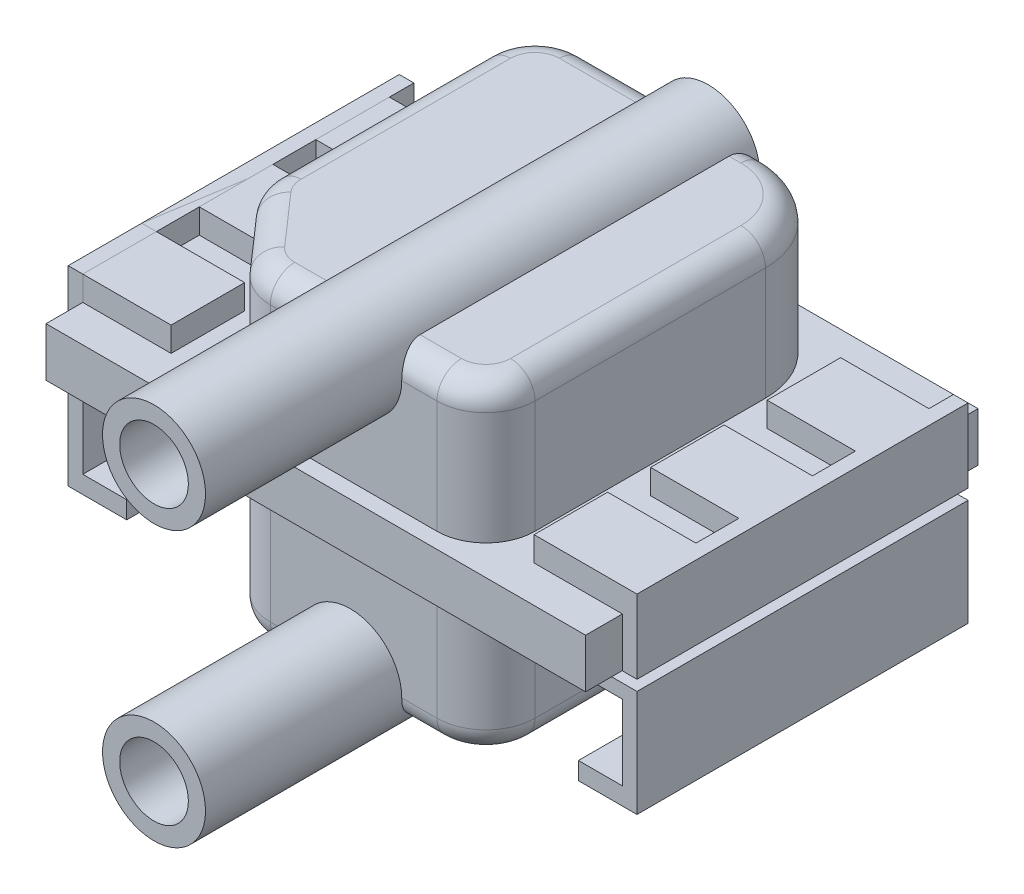
from build123d import *

# Parameters (mm, degrees)
SKETCH1_W               = 11
SKETCH1_H               = 8
BOSS_EXTRUDE1_DEPTH     = 0.5
BOSS_EXTRUDE2_DEPTH     = 2.8
FILLET2_R               = 0.5
BOSS_EXTRUDE3_REACH     = 12.007
SKETCH3_R               = 1.05
SKETCH3_R_2             = 0.7
BOSS_EXTRUDE4_START     = 4
SKETCH3_2_R             = 1.05
SKETCH3_2_R_2           = 0.7
BOSS_EXTRUDE4_DEPTH     = 4
SKETCH4_W               = 1.8
SKETCH4_H               = 1.5
BOSS_EXTRUDE5_DEPTH     = 0.5
LPATTERN1_COUNT         = 3
LPATTERN1_PITCH         = 2.375
SKETCH5_W               = 1.8
SKETCH5_H               = 1.5
BOSS_EXTRUDE6_DEPTH     = 0.5
LPATTERN2_COUNT         = 3
LPATTERN2_PITCH         = 2.375
BOSS_EXTRUDE7_START     = -1.5
BOSS_EXTRUDE7_OUTLINE_W = 0.297986137
BOSS_EXTRUDE7_OUTLINE_H = 1.504928383
BOSS_EXTRUDE7_DEPTH     = 1.5
LPATTERN6_START         = -2.891862555
LPATTERN6_OUTLINE_W     = 0.297986137
LPATTERN6_OUTLINE_H     = 5.25
LPATTERN6_DEPTH         = 2.172722131
LPATTERN6_2_OUTLINE_W   = 0.89548095
LPATTERN6_2_OUTLINE_H   = 5.25
LPATTERN6_2_DEPTH       = 0.357020068
LPATTERN6_START_2       = -1.004756479
LPATTERN6_3_OUTLINE_W   = 0.89548095
LPATTERN6_3_OUTLINE_H   = 5.25
LPATTERN6_3_DEPTH       = 0.285616055
LPATTERN6_START_3       = -0.719140424
LPATTERN6_4_OUTLINE_W   = 0.346819496
LPATTERN6_4_OUTLINE_H   = 5.25
LPATTERN6_4_DEPTH       = 0.219140424
LPATTERN6_START_4       = -3.5
LPATTERN6_5_OUTLINE_W   = 0.297986137
LPATTERN6_5_OUTLINE_H   = 1.504928383
LPATTERN6_5_DEPTH       = 5.25
LPATTERN6_6_OUTLINE_W   = 0.297986137
LPATTERN6_6_OUTLINE_H   = 1.875
LPATTERN6_6_DEPTH       = 2.172722131
LPATTERN6_7_OUTLINE_W   = 0.89548095
LPATTERN6_7_OUTLINE_H   = 1.875
LPATTERN6_7_DEPTH       = 0.357020068
LPATTERN6_8_OUTLINE_W   = 0.89548095
LPATTERN6_8_OUTLINE_H   = 1.875
LPATTERN6_8_DEPTH       = 0.285616055
LPATTERN6_9_OUTLINE_W   = 0.346819496
LPATTERN6_9_OUTLINE_H   = 1.875
LPATTERN6_9_DEPTH       = 0.219140424
LPATTERN6_START_5       = -0.125
LPATTERN6_10_OUTLINE_W  = 0.297986137
LPATTERN6_10_OUTLINE_H  = 1.504928383
LPATTERN6_10_DEPTH      = 1.875


# Read off the part's stored shape, not the designer's step: Boss-Extrude7, LPattern6
with BuildPart() as part:
    # Sketch1 → Boss-Extrude1 (new body)
    with BuildSketch(Plane(origin=(0, 0, 0), x_dir=(1, 0, 0), z_dir=(0, 1, 0))):
        Rectangle(SKETCH1_W, SKETCH1_H)
    extrude(amount=BOSS_EXTRUDE1_DEPTH)

    # Sketch2 → Boss-Extrude2 (add)
    with BuildSketch(Plane(origin=(0, 0.5, 0), x_dir=(1, 0, 0), z_dir=(0, 1, 0))):
        with BuildLine():
            Line((1.547204694, 3.619409135), (-2.15, 3.619409135))
            ThreePointArc((-2.15, 3.619409135), (-2.857106781, 3.326515916), (-3.15, 2.619409135))
            Line((-3.15, 2.619409135), (-3.15, -1.652100377))
            ThreePointArc((-3.15, -1.652100377), (-3.0858236, -2.004569084), (-2.901531621, -2.311797445))
            Line((-2.901531621, -2.311797445), (-1.998719096, -3.340287934))
            ThreePointArc((-1.998719096, -3.340287934), (-1.659681675, -3.591551092), (-1.247187475, -3.680590865))
            Line((-1.247187475, -3.680590865), (2.15, -3.680590865))
            ThreePointArc((2.15, -3.680590865), (2.857106781, -3.387697647), (3.15, -2.680590865))
            Line((3.15, -2.680590865), (3.15, 2.016613829))
            ThreePointArc((3.15, 2.016613829), (2.680552124, 3.149961258), (1.547204694, 3.619409135))
        make_face()
    extrude(amount=BOSS_EXTRUDE2_DEPTH)

    # Fillet2
    fillet2_edges = [part.edges().sort_by_distance(p)[0] for p in [
        (-2.857106781, 3.3, -3.326515916),
        (-3.15, 3.3, -0.483654379),
        (-3.0858236, 3.3, 2.004569084),
        (-2.450125358, 3.3, 2.82604269),
        (-1.659681675, 3.3, 3.591551092),
        (0.451406263, 3.3, 3.680590865),
        (2.857106781, 3.3, 3.387697647),
        (3.15, 3.3, 0.331988518),
        (2.680552124, 3.3, -3.149961258),
        (-0.301397653, 3.3, -3.619409135),
    ]]
    fillet(fillet2_edges, radius=FILLET2_R)

    # Boss-Extrude3: up to this face of the body (flat: up to its plane)
    boss_extrude3_end = Plane(part.part.faces().sort_by_distance((-0.301397653, 1.65, -3.619409135))[0])
    # Sketch3 → Boss-Extrude3 (add, up to the picked face)
    with BuildSketch(Plane.XY.offset(3.680590865), mode=Mode.PRIVATE) as boss_extrude3_sk1:
        with Locations((0.382781225, 2.8)):
            Circle(SKETCH3_R)
        with Locations((0.382781225, 2.8)):
            Circle(SKETCH3_R_2, mode=Mode.SUBTRACT)
    boss_extrude3_tool1 = split(extrude(boss_extrude3_sk1.sketch, amount=-BOSS_EXTRUDE3_REACH, mode=Mode.PRIVATE), bisect_by=boss_extrude3_end, keep=Keep.BOTH, mode=Mode.PRIVATE)
    add(boss_extrude3_tool1.solids().sort_by(Axis((-0.63752, 2.8, 3.680591), (0, 0, -1)))[0])

    # Sketch3<2> → Boss-Extrude4 (add)
    with BuildSketch(Plane.XY.offset(3.680590865).offset(BOSS_EXTRUDE4_START)):
        with Locations((0.382781225, 2.8)):
            Circle(SKETCH3_2_R)
        with Locations((0.382781225, 2.8)):
            Circle(SKETCH3_2_R_2, mode=Mode.SUBTRACT)
    extrude(amount=-BOSS_EXTRUDE4_DEPTH)

    # Mirror2: part across plane


with BuildPart() as part_1:
    add(part.part)
    add(part.part.mirror(Plane(origin=(0, 0, 0), x_dir=(0, 0, 1), z_dir=(0, -1, 0))))


with BuildPart() as body_2:
    # Sketch4 → Boss-Extrude5 (new body)
    with BuildSketch(Plane(origin=(0, 0.5, 0), x_dir=(1, 0, 0), z_dir=(0, 1, 0))):
        with Locations((-4.6, 2.25)):
            Rectangle(SKETCH4_W, SKETCH4_H)
    boss_extrude5 = extrude(amount=BOSS_EXTRUDE5_DEPTH)


with BuildPart() as lpattern1_1:
    # LPattern1: Boss-Extrude5 ×3
    with Locations(*[(0, 0, i * LPATTERN1_PITCH) for i in range(1, LPATTERN1_COUNT)]):
        add(boss_extrude5)


with BuildPart() as body_5:
    # Sketch5 → Boss-Extrude6 (new body)
    with BuildSketch(Plane(origin=(0, 0.5, 0), x_dir=(1, 0, 0), z_dir=(0, 1, 0))):
        with Locations((4.6, 2.25)):
            Rectangle(SKETCH5_W, SKETCH5_H)
    boss_extrude6 = extrude(amount=BOSS_EXTRUDE6_DEPTH)


with BuildPart() as lpattern2_1:
    # LPattern2: pattern copy
    add(boss_extrude6.moved(Location(Vector(0, 0, 1) * (1 * LPATTERN2_PITCH))))


with BuildPart() as lpattern2_2:
    # LPattern2: pattern copy
    add(boss_extrude6.moved(Location(Vector(0, 0, 1) * (2 * LPATTERN2_PITCH))))


with BuildPart() as body_8:
    # Boss-Extrude7 outline → Boss-Extrude7 (new body)
    with BuildSketch(Plane.XY.offset(3.25).offset(BOSS_EXTRUDE7_START)):
        Polygon((-4.951338546, -0.5), (-4.951338546, -0.719140424), (-5.797986137, -0.719140424), (-5.797986137, -2.891862555), (-4.60451905, -2.891862555), (-4.60451905, -2.534842487), (-5.5, -2.534842487), (-5.5, -1.004756479), (-4.60451905, -1.004756479), (-4.60451905, -0.5), align=None)
        with Locations((-5.648993069, 0.247535809)):
            Rectangle(BOSS_EXTRUDE7_OUTLINE_W, BOSS_EXTRUDE7_OUTLINE_H)
    boss_extrude7 = extrude(amount=BOSS_EXTRUDE7_DEPTH)


with BuildPart() as body_9:
    # LPattern6 outline → LPattern6 (new body)
    with BuildSketch(Plane(origin=(0, 0, 0), x_dir=(1, 0, 0), z_dir=(0, 1, 0)).offset(LPATTERN6_START)):
        with Locations((-5.648993069, 0.875)):
            Rectangle(LPATTERN6_OUTLINE_W, LPATTERN6_OUTLINE_H)
    lpattern6 = extrude(amount=LPATTERN6_DEPTH)

    # LPattern6 2 outline → LPattern6 2 (add)
    with BuildSketch(Plane(origin=(0, 0, 0), x_dir=(1, 0, 0), z_dir=(0, 1, 0)).offset(LPATTERN6_START)):
        with Locations((-5.052259525, 0.875)):
            Rectangle(LPATTERN6_2_OUTLINE_W, LPATTERN6_2_OUTLINE_H)
    lpattern6_2 = extrude(amount=LPATTERN6_2_DEPTH)

    # LPattern6 3 outline → LPattern6 3 (add)
    with BuildSketch(Plane(origin=(0, 0, 0), x_dir=(1, 0, 0), z_dir=(0, 1, 0)).offset(LPATTERN6_START_2)):
        with Locations((-5.052259525, 0.875)):
            Rectangle(LPATTERN6_3_OUTLINE_W, LPATTERN6_3_OUTLINE_H)
    lpattern6_3 = extrude(amount=LPATTERN6_3_DEPTH)

    # LPattern6 4 outline → LPattern6 4 (add)
    with BuildSketch(Plane(origin=(0, 0, 0), x_dir=(1, 0, 0), z_dir=(0, 1, 0)).offset(LPATTERN6_START_3)):
        with Locations((-4.777928798, 0.875)):
            Rectangle(LPATTERN6_4_OUTLINE_W, LPATTERN6_4_OUTLINE_H)
    lpattern6_4 = extrude(amount=LPATTERN6_4_DEPTH)


with BuildPart() as body_10:
    # LPattern6 5 outline → LPattern6 5 (new body)
    with BuildSketch(Plane.XY.offset(LPATTERN6_START_4)):
        with Locations((-5.648993069, 0.247535809)):
            Rectangle(LPATTERN6_5_OUTLINE_W, LPATTERN6_5_OUTLINE_H)
    lpattern6_5 = extrude(amount=LPATTERN6_5_DEPTH)


with BuildPart() as body_11:
    # LPattern6 6 outline → LPattern6 6 (new body)
    with BuildSketch(Plane(origin=(0, 0, 0), x_dir=(1, 0, 0), z_dir=(0, 1, 0)).offset(LPATTERN6_START)):
        with Locations((-5.648993069, -0.8125)):
            Rectangle(LPATTERN6_6_OUTLINE_W, LPATTERN6_6_OUTLINE_H)
    lpattern6_6 = extrude(amount=LPATTERN6_6_DEPTH)

    # LPattern6 7 outline → LPattern6 7 (add)
    with BuildSketch(Plane(origin=(0, 0, 0), x_dir=(1, 0, 0), z_dir=(0, 1, 0)).offset(LPATTERN6_START)):
        with Locations((-5.052259525, -0.8125)):
            Rectangle(LPATTERN6_7_OUTLINE_W, LPATTERN6_7_OUTLINE_H)
    lpattern6_7 = extrude(amount=LPATTERN6_7_DEPTH)

    # LPattern6 8 outline → LPattern6 8 (add)
    with BuildSketch(Plane(origin=(0, 0, 0), x_dir=(1, 0, 0), z_dir=(0, 1, 0)).offset(LPATTERN6_START_2)):
        with Locations((-5.052259525, -0.8125)):
            Rectangle(LPATTERN6_8_OUTLINE_W, LPATTERN6_8_OUTLINE_H)
    lpattern6_8 = extrude(amount=LPATTERN6_8_DEPTH)

    # LPattern6 9 outline → LPattern6 9 (add)
    with BuildSketch(Plane(origin=(0, 0, 0), x_dir=(1, 0, 0), z_dir=(0, 1, 0)).offset(LPATTERN6_START_3)):
        with Locations((-4.777928798, -0.8125)):
            Rectangle(LPATTERN6_9_OUTLINE_W, LPATTERN6_9_OUTLINE_H)
    lpattern6_9 = extrude(amount=LPATTERN6_9_DEPTH)


with BuildPart() as body_12:
    # LPattern6 10 outline → LPattern6 10 (new body)
    with BuildSketch(Plane.XY.offset(LPATTERN6_START_5)):
        with Locations((-5.648993069, 0.247535809)):
            Rectangle(LPATTERN6_10_OUTLINE_W, LPATTERN6_10_OUTLINE_H)
    lpattern6_10 = extrude(amount=LPATTERN6_10_DEPTH)


with BuildPart() as part_2:
    add(part_1.part)

    add(body_5.part)  # Mirror3 merges body 5

    add(lpattern2_1.part)  # Mirror3 merges LPattern2_1

    add(lpattern2_2.part)  # Mirror3 merges LPattern2_2
    # Mirror3: Boss-Extrude7, LPattern6, LPattern6 2, LPattern6 3, LPattern6 4, LPattern6 5, LPattern6 6, LPattern6 7, LPattern6 8, LPattern6 9, LPattern6 10 across plane
    add(boss_extrude7.mirror(Plane(origin=(0, 0, 0), x_dir=(0, 0, 1), z_dir=(1, 0, 0))))
    add(lpattern6.mirror(Plane(origin=(0, 0, 0), x_dir=(0, 0, 1), z_dir=(1, 0, 0))))
    add(lpattern6_2.mirror(Plane(origin=(0, 0, 0), x_dir=(0, 0, 1), z_dir=(1, 0, 0))))
    add(lpattern6_3.mirror(Plane(origin=(0, 0, 0), x_dir=(0, 0, 1), z_dir=(1, 0, 0))))
    add(lpattern6_4.mirror(Plane(origin=(0, 0, 0), x_dir=(0, 0, 1), z_dir=(1, 0, 0))))
    add(lpattern6_5.mirror(Plane(origin=(0, 0, 0), x_dir=(0, 0, 1), z_dir=(1, 0, 0))))
    add(lpattern6_6.mirror(Plane(origin=(0, 0, 0), x_dir=(0, 0, 1), z_dir=(1, 0, 0))))
    add(lpattern6_7.mirror(Plane(origin=(0, 0, 0), x_dir=(0, 0, 1), z_dir=(1, 0, 0))))
    add(lpattern6_8.mirror(Plane(origin=(0, 0, 0), x_dir=(0, 0, 1), z_dir=(1, 0, 0))))
    add(lpattern6_9.mirror(Plane(origin=(0, 0, 0), x_dir=(0, 0, 1), z_dir=(1, 0, 0))))
    add(lpattern6_10.mirror(Plane(origin=(0, 0, 0), x_dir=(0, 0, 1), z_dir=(1, 0, 0))))


solid = Compound([body_2.part, lpattern1_1.part, body_8.part, body_9.part, body_10.part, body_11.part, body_12.part, part_2.part])
